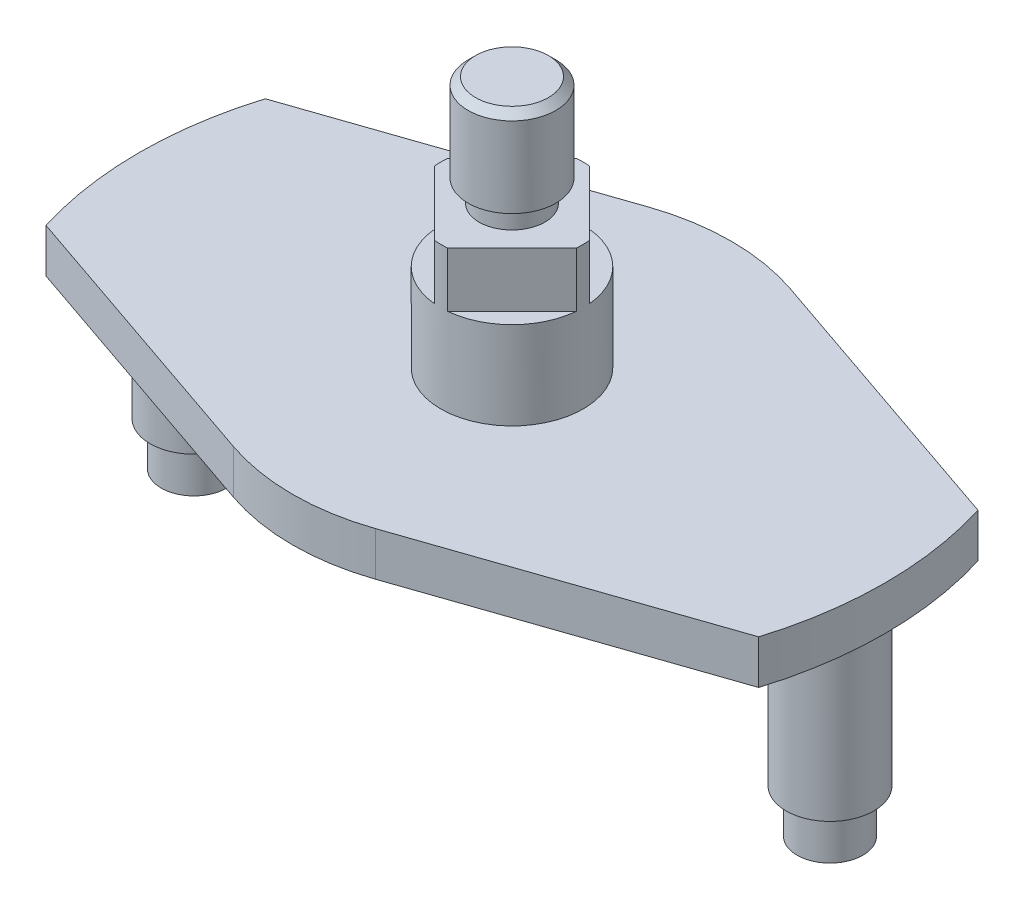
from build123d import *

# Parameters (mm, degrees)
EXTRUDE_1_DEPTH      = 4
SKETCH_2_R           = 6.5
EXTRUDE_2_DEPTH      = 13
SKETCH_3_R           = 4
EXTRUDE_3_DEPTH      = 10
SKETCH_4_OUTSIDE_W   = 86.676
SKETCH_4_OUTSIDE_H   = 58.676
SKETCH_4_OUTSIDE_R   = 3
CUT_EXTRUDE_1_DEPTH  = 2
SKETCH_6_OUTSIDE_W   = 86.676
SKETCH_6_OUTSIDE_H   = 58.676
CUT_EXTRUDE_2_DEPTH  = 5
SKETCH_7_R           = 4
EXTRUDE_4_DEPTH      = 18.5
SKETCH_8_OUTSIDE_W   = 88.214
SKETCH_8_OUTSIDE_H   = 60.214
SKETCH_8_OUTSIDE_R   = 3
CUT_EXTRUDE_3_DEPTH  = 4
MIRROR_START         = -14.5
MIRROR_1_OUTLINE_R   = 4
MIRROR_1_DEPTH       = 14.5
MIRROR_START_2       = -18.5
MIRROR_1_2_OUTLINE_R = 3
MIRROR_1_2_DEPTH     = 4


# Read off the part's stored shape, not the designer's step: M8 机械螺纹 螺柱1, 镜向1
with BuildPart() as part:
    # 草图1 → 凸台-拉伸1 (new body)
    with BuildSketch(Plane(origin=(0, 0, 0), x_dir=(1, 0, 0), z_dir=(0, 1, 0))):
        with BuildLine():
            Line((-6.487344821, 18.918624611), (-32.496153619, 10))
            ThreePointArc((-32.496153619, 10), (-34, 0), (-32.496153619, -10))
            Line((-32.496153619, -10), (-6.487344821, -18.918624611))
            ThreePointArc((-6.487344821, -18.918624611), (0, -20), (6.487344821, -18.918624611))
            Line((6.487344821, -18.918624611), (32.496153619, -10))
            ThreePointArc((32.496153619, -10), (33.621936463, -5.056222749), (34, 0))
            ThreePointArc((34, 0), (33.621936463, 5.056222749), (32.496153619, 10))
            Line((32.496153619, 10), (6.487344821, 18.918624611))
            ThreePointArc((6.487344821, 18.918624611), (0, 20), (-6.487344821, 18.918624611))
        make_face()
    extrude(amount=EXTRUDE_1_DEPTH)

    # 草图2 → 凸台-拉伸2 (add)
    with BuildSketch(Plane(origin=(0, 4, 0), x_dir=(1, 0, 0), z_dir=(0, 1, 0))):
        with Locations(Location((0, 0, 0), (0, 0, 90))):
            Circle(SKETCH_2_R)
    extrude(amount=EXTRUDE_2_DEPTH)

    # 草图3 → 凸台-拉伸3 (add)
    with BuildSketch(Plane(origin=(0, 17, 0), x_dir=(1, 0, 0), z_dir=(0, 1, 0))):
        with Locations(Location((0, 0, 0), (0, 0, 270))):
            Circle(SKETCH_3_R)
    extrude(amount=EXTRUDE_3_DEPTH)

    # 草图4 outside → 切除-拉伸1 (cut)
    with BuildSketch(Plane(origin=(0, 17, 0), x_dir=(1, 0, 0), z_dir=(0, 1, 0))):
        Rectangle(SKETCH_4_OUTSIDE_W, SKETCH_4_OUTSIDE_H)
        with Locations(Location((0, 0, 0), (0, 0, 270))):
            Circle(SKETCH_4_OUTSIDE_R, mode=Mode.SUBTRACT)
    extrude(amount=CUT_EXTRUDE_1_DEPTH, mode=Mode.SUBTRACT)

    # M8 机械螺纹 螺柱1 outline → M8 机械螺纹 螺柱1 (revolve, cut)
    with BuildSketch(Plane.XY):
        Polygon((4, 27), (3.3235, 27), (4, 26.3235), align=None)
    revolve(axis=Axis((0, 0, 0), (0, 1, 0)), mode=Mode.SUBTRACT)

    # 草图6 outside → 切除-拉伸2 (cut)
    with BuildSketch(Plane(origin=(0, 17, 0), x_dir=(1, 0, 0), z_dir=(0, 1, 0))):
        Rectangle(SKETCH_6_OUTSIDE_W, SKETCH_6_OUTSIDE_H)
        Polygon((0, -7.071067812), (7.071067812, 0), (0, 7.071067812), (-7.071067812, 0), align=None, mode=Mode.SUBTRACT)
    extrude(amount=-CUT_EXTRUDE_2_DEPTH, mode=Mode.SUBTRACT)

    # 草图7 → 凸台-拉伸4 (add)
    with BuildSketch(Plane.XZ):
        with Locations(Location((29, 0, 0), (0, 0, 90))):
            Circle(SKETCH_7_R)
    extrude(amount=EXTRUDE_4_DEPTH)

    # 草图8 outside → 切除-拉伸3 (cut)
    with BuildSketch(Plane.XZ.offset(18.5)):
        Rectangle(SKETCH_8_OUTSIDE_W, SKETCH_8_OUTSIDE_H)
        with Locations(Location((29, 0, 0), (0, 0, 270))):
            Circle(SKETCH_8_OUTSIDE_R, mode=Mode.SUBTRACT)
    extrude(amount=-CUT_EXTRUDE_3_DEPTH, mode=Mode.SUBTRACT)

    # 镜向1 outline → 镜向1 (add)
    with BuildSketch(Plane(origin=(0, 0, 0), x_dir=(1, 0, 0), z_dir=(0, 1, 0)).offset(MIRROR_START)):
        with Locations((-29, 0)):
            Circle(MIRROR_1_OUTLINE_R)
    extrude(amount=MIRROR_1_DEPTH)

    # Mirror 1 2 outline → Mirror 1 2 (add)
    with BuildSketch(Plane(origin=(0, 0, 0), x_dir=(1, 0, 0), z_dir=(0, 1, 0)).offset(MIRROR_START_2)):
        with Locations((-29, 0)):
            Circle(MIRROR_1_2_OUTLINE_R)
    extrude(amount=MIRROR_1_2_DEPTH)


solid = part.part
